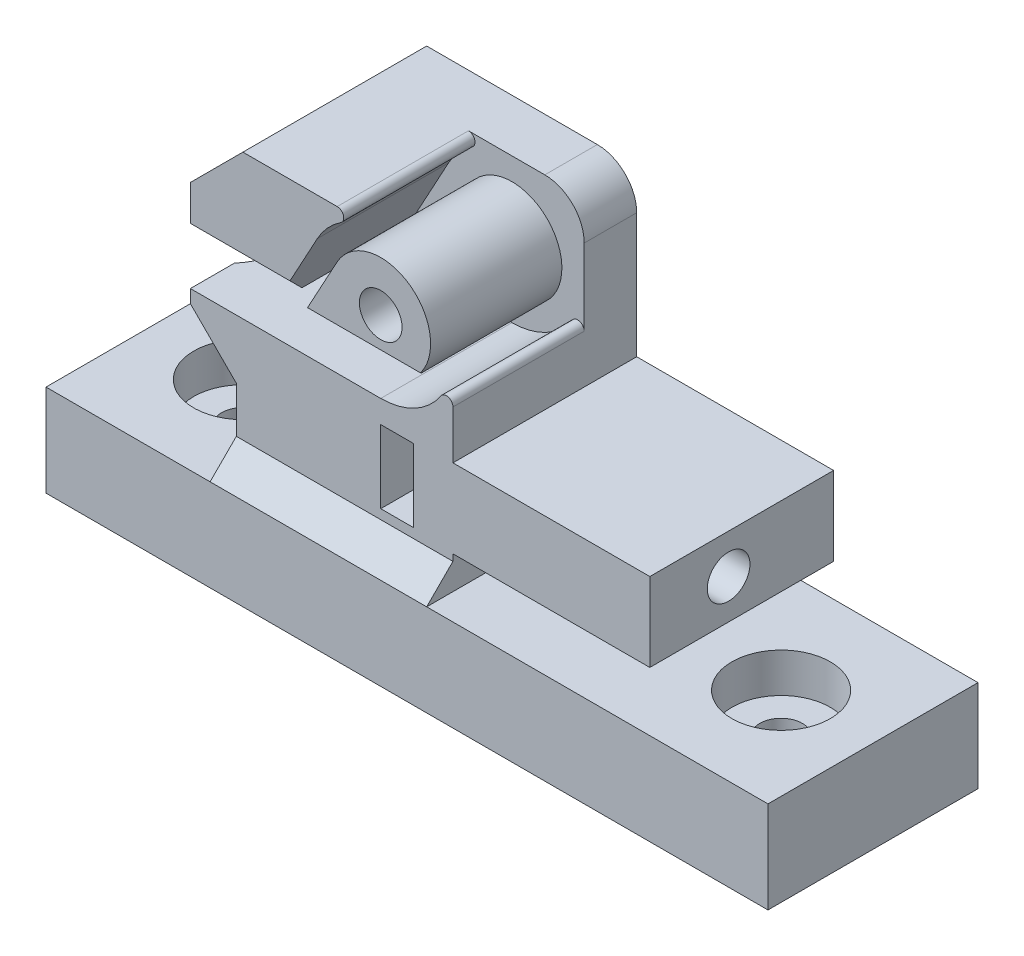
from build123d import *

# Parameters (mm, degrees)
BOSS_EXTRUDE1_DEPTH = 16
CUT_EXTRUDE1_START  = 2
CUT_EXTRUDE1_DEPTH  = 14
SKETCH7_R           = 1.625
CUT_EXTRUDE2_DEPTH  = 55.539321396
CUT_EXTRUDE3_START  = -18
SKETCH8_W           = 10.868969255
SKETCH8_H           = 5.55
CUT_EXTRUDE3_DEPTH  = 2.5
SKETCH9_R           = 1.625
CUT_EXTRUDE4_DEPTH  = 8
SKETCH16_R          = 3.75
CUT_EXTRUDE9_DEPTH  = 3
SKETCH21_W          = 35
SKETCH21_H          = 21
CUT_EXTRUDE13_DEPTH = 2
FILLET2_R           = 0.5
FILLET3_R           = 3
FILLET4_R           = 1
CHAMFER3_SIZE       = 3.5
CHAMFER4_SIZE       = 4
SKETCH18_R          = 1.625
CUT_EXTRUDE11_DEPTH = 20
SKETCH19_R          = 4
CUT_EXTRUDE12_DEPTH = 5
CHAMFER9_SIZE       = 2
CHAMFER12_SIZE      = 1.5
CHAMFER11_SIZE      = 2


# Some blends are built 0.0001 mm under size
with BuildPart() as part:
    # Sketch4 → Boss-Extrude1 (new body)
    with BuildSketch(Plane.XY):
        Polygon((-3.5, -0.026126862), (-3.5, 6.973873138), (9, 6.973873138), (9, 12.473873138), (5.5, 12.473873138), (5.5, 27.973873138), (25.5, 27.973873138), (25.5, 15.473873138), (40.5, 15.473873138), (40.5, 9.473873138), (25.5, 9.473873138), (25.5, 6.973873138), (51.5, 6.973873138), (51.5, -0.026126862), align=None)
    extrude(amount=-BOSS_EXTRUDE1_DEPTH)

    # Sketch6 → Cut-Extrude1 (cut)
    with BuildSketch(Plane.XY.offset(CUT_EXTRUDE1_START)):
        with BuildLine():
            Line((12, 19.273873138), (5.5, 19.273873138))
            Line((5.5, 19.273873138), (5.5, 16.973873138))
            Line((5.5, 16.973873138), (20, 16.973873138))
            ThreePointArc((20, 16.973873138), (23.888996032, 18.58469458), (25.499999994, 22.473615007))
            Line((25.499999994, 22.473615007), (25.5, 27.973873138))
            Line((25.5, 27.973873138), (20, 27.973873138))
            ThreePointArc((20, 27.973873138), (17.189181506, 27.201377701), (15.167942816, 25.100891099))
            Line((15.167942816, 25.100891099), (12, 19.273873138))
        make_face()
        with BuildLine():
            Line((20, 18.673873138), (13.608794956, 18.673873138))
            Line((13.608794956, 18.673873138), (16.661487764, 24.28890373))
            ThreePointArc((16.661487764, 24.28890373), (23.26627588, 24.415893189), (20, 18.673873138))
        make_face(mode=Mode.SUBTRACT)
    extrude(amount=-CUT_EXTRUDE1_DEPTH, mode=Mode.SUBTRACT)

    # Sketch7 → Cut-Extrude2 (cut, through all)
    with BuildSketch(Plane(origin=(40.5, 0, 0), x_dir=(0, 0, -1), z_dir=(1, 0, 0))):
        with Locations((8, 12.473873138)):
            Circle(SKETCH7_R)
    extrude(amount=-CUT_EXTRUDE2_DEPTH, mode=Mode.SUBTRACT)

    # Sketch8 → Cut-Extrude3 (cut)
    with BuildSketch(Plane(origin=(40.5, 0, 0), x_dir=(0, 0, -1), z_dir=(1, 0, 0)).offset(CUT_EXTRUDE3_START)):
        with Locations((5.434484628, 12.473873138)):
            Rectangle(SKETCH8_W, SKETCH8_H)
    extrude(amount=-CUT_EXTRUDE3_DEPTH, mode=Mode.SUBTRACT)

    # Sketch9 → Cut-Extrude4 (cut)
    with BuildSketch(Plane.XZ.offset(0.026126862)):
        with Locations((3.5, -8)):
            Circle(SKETCH9_R)
        with Locations((44.5, -8)):
            Circle(SKETCH9_R)
    extrude(amount=-CUT_EXTRUDE4_DEPTH, mode=Mode.SUBTRACT)

    # Sketch16 → Cut-Extrude9 (cut)
    with BuildSketch(Plane(origin=(0, 6.973873138, 0), x_dir=(1, 0, 0), z_dir=(0, 1, 0))):
        with Locations(Location((3.5, 8, 0), (0, 0, 180))):
            Circle(SKETCH16_R)
        with Locations(Location((44.5, 8, 0), (0, 0, 180))):
            Circle(SKETCH16_R)
    extrude(amount=-CUT_EXTRUDE9_DEPTH, mode=Mode.SUBTRACT)

    # Sketch21 → Cut-Extrude13 (cut)
    with BuildSketch(Plane.XY):
        with Locations((23, 17.473873138)):
            Rectangle(SKETCH21_W, SKETCH21_H)
    extrude(amount=-CUT_EXTRUDE13_DEPTH, mode=Mode.SUBTRACT)

    # Fillet2
    fillet2_edges = [part.edges().sort_by_distance(p)[0] for p in [
        (20, 27.973873138, -7),
        (25.499999994, 22.473615007, -7),
    ]]
    fillet(fillet2_edges, radius=FILLET2_R)

    # Fillet3
    fillet3_edges = [part.edges().sort_by_distance(p)[0] for p in [
        (25.5, 27.973873138, -14),
    ]]
    fillet(fillet3_edges, radius=FILLET3_R)

    # Fillet4
    fillet4_edges = [part.edges().sort_by_distance(p)[0] for p in [
        (13.608794956, 18.673873138, -7),
    ]]
    fillet(fillet4_edges, radius=FILLET4_R)

    # Chamfer3
    # the kernel refuses this chamfer: 3.5 mm, written as the material it takes off along each edge
    with BuildSketch(Plane(origin=(5.5, 12.473873138, 7.000890458), x_dir=(-0.02749587661058662, 0.9996219169112968, 0), z_dir=(0, 0, -1))) as chamfer3_piece_1_section:
        Polygon((CHAMFER3_SIZE * 0.999621916911, CHAMFER3_SIZE * 0.0274958766106), (-CHAMFER3_SIZE * 0.0274958766106, CHAMFER3_SIZE * 0.999621916911), (0, 0), align=None)
    chamfer3_piece_1 = extrude(amount=22.376780916, mode=Mode.PRIVATE)
    chamfer3_piece_1 = split(chamfer3_piece_1, bisect_by=Plane(origin=(9, 13.630287679, -4.1875), z_dir=(-1, 0, 0)), keep=Keep.TOP, mode=Mode.PRIVATE)
    add(chamfer3_piece_1, mode=Mode.SUBTRACT)
    with BuildSketch(Plane(origin=(5.5, 12.473873138, -0.624109542), x_dir=(-0.02749587661058662, 0.9996219169112968, 0), z_dir=(0, 0, -1))) as chamfer3_piece_2_section:
        Polygon((CHAMFER3_SIZE * 0.999621916911, CHAMFER3_SIZE * 0.0274958766106), (-CHAMFER3_SIZE * 0.0274958766106, CHAMFER3_SIZE * 0.999621916911), (0, 0), align=None)
    chamfer3_piece_2 = extrude(amount=24.376780916, mode=Mode.PRIVATE)
    chamfer3_piece_2 = split(chamfer3_piece_2, bisect_by=Plane(origin=(9, 13.630287679, -12.8125), z_dir=(-1, 0, 0)), keep=Keep.TOP, mode=Mode.PRIVATE)
    add(chamfer3_piece_2, mode=Mode.SUBTRACT)

    # Chamfer4
    chamfer4_edges = [part.edges().sort_by_distance(p)[0] for p in [
        (5.5, 27.973873138, -9),
    ]]
    chamfer(chamfer4_edges, length=CHAMFER4_SIZE)

    # Sketch18 → Cut-Extrude11 (cut)
    with BuildSketch(Plane.XY):
        with Locations((20, 22.473873138)):
            Circle(SKETCH18_R)
    extrude(amount=-CUT_EXTRUDE11_DEPTH, mode=Mode.SUBTRACT)

    # Sketch19 → Cut-Extrude12 (cut)
    with BuildSketch(Plane(origin=(0, 16.973873138, 0), x_dir=(1, 0, 0), z_dir=(0, 1, 0))):
        with Locations((2.5, 8)):
            Circle(SKETCH19_R)
    extrude(amount=-CUT_EXTRUDE12_DEPTH, mode=Mode.SUBTRACT)

    # Chamfer9
    chamfer9_edges = [part.edges().sort_by_distance(p)[0] for p in [
        (17.25, 6.973873138, -2),
    ]]
    chamfer(chamfer9_edges, length=CHAMFER9_SIZE - 0.0001)  # a hair under: the kernel refuses the full size

    # Chamfer12
    # the kernel refuses this chamfer: 1.5 mm, written as the material it takes off along each edge
    with BuildSketch(Plane(origin=(23.857524482, 18.673873138, -2), x_dir=(0, 0.9996219169112968, 0.027495876610586334), z_dir=(-1, 0, 0))) as chamfer12_piece_1_section:
        Polygon((CHAMFER12_SIZE * 0.999621916911, CHAMFER12_SIZE * 0.0274958766106), (-CHAMFER12_SIZE * 0.0274958766106, CHAMFER12_SIZE * 0.999621916911), (0, 0), align=None)
    chamfer12_piece_1 = extrude(amount=12.424357944, mode=Mode.PRIVATE)
    chamfer12_piece_1 = split(chamfer12_piece_1, bisect_by=Plane(origin=(15.45343037, 22.066839589, -2.289421032), z_dir=(0.8785558517032834, -0.47763962925820797, 0)), keep=Keep.TOP, mode=Mode.PRIVATE)
    add(chamfer12_piece_1, mode=Mode.SUBTRACT)

    # Chamfer11
    chamfer11_edges = [part.edges().sort_by_distance(p)[0] for p in [
        (8.75, 19.273873138, -2),
    ]]
    chamfer(chamfer11_edges, length=CHAMFER11_SIZE)


solid = part.part
